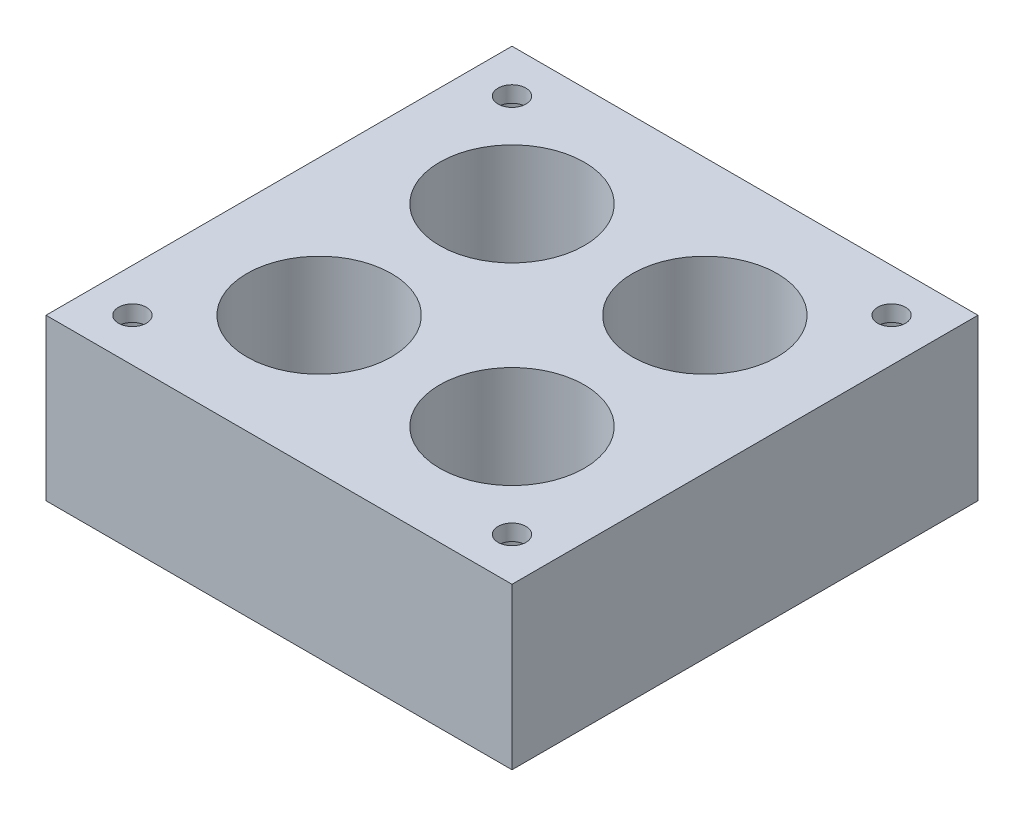
from build123d import *

# Parameters (mm, degrees)
SKETCH1_W           = 36.83
SKETCH1_H           = 36.83
SKETCH1_R           = 1.0999978
SKETCH1_R_2         = 2.159
BOSS_EXTRUDE1_DEPTH = 12.7
SKETCH2_R           = 5.715
CUT_EXTRUDE1_DEPTH  = 11.43
SKETCH3_R           = 2.54
CUT_EXTRUDE2_DEPTH  = 11.43


with BuildPart() as part:
    # Sketch1 → Boss-Extrude1 (new body)
    with BuildSketch(Plane(origin=(0, 0, 0), x_dir=(1, 0, 0), z_dir=(0, 1, 0))):
        with Locations((-1.422532637, -3.27613577)):
            Rectangle(SKETCH1_W, SKETCH1_H)
        with Locations((-16.422528037, 11.72385963)):
            Circle(SKETCH1_R, mode=Mode.SUBTRACT)
        with Locations((13.577462763, 11.72385963)):
            Circle(SKETCH1_R, mode=Mode.SUBTRACT)
        with Locations((13.577462763, -18.27613117)):
            Circle(SKETCH1_R, mode=Mode.SUBTRACT)
        with Locations((-16.422528037, -18.27613117)):
            Circle(SKETCH1_R, mode=Mode.SUBTRACT)
        with Locations((-9.042532637, 4.34386423)):
            Circle(SKETCH1_R_2, mode=Mode.SUBTRACT)
        with Locations((6.197467363, 4.34386423)):
            Circle(SKETCH1_R_2, mode=Mode.SUBTRACT)
        with Locations((6.197467363, -10.89613577)):
            Circle(SKETCH1_R_2, mode=Mode.SUBTRACT)
        with Locations((-9.042532637, -10.89613577)):
            Circle(SKETCH1_R_2, mode=Mode.SUBTRACT)
    extrude(amount=BOSS_EXTRUDE1_DEPTH)

    # Sketch2 → Cut-Extrude1 (cut)
    with BuildSketch(Plane(origin=(0, 12.7, 0), x_dir=(1, 0, 0), z_dir=(0, 1, 0))):
        with Locations((-9.042532637, 4.34386423)):
            Circle(SKETCH2_R)
        with Locations((6.197467363, 4.34386423)):
            Circle(SKETCH2_R)
        with Locations((6.197467363, -10.89613577)):
            Circle(SKETCH2_R)
        with Locations((-9.042532637, -10.89613577)):
            Circle(SKETCH2_R)
    extrude(amount=-CUT_EXTRUDE1_DEPTH, mode=Mode.SUBTRACT)

    # Sketch3 → Cut-Extrude2 (cut)
    with BuildSketch(Plane.XZ):
        with Locations((-16.422528037, 18.27613117)):
            Circle(SKETCH3_R)
        with Locations((13.577462763, 18.27613117)):
            Circle(SKETCH3_R)
        with Locations((13.577462763, -11.72385963)):
            Circle(SKETCH3_R)
        with Locations((-16.422528037, -11.72385963)):
            Circle(SKETCH3_R)
    extrude(amount=-CUT_EXTRUDE2_DEPTH, mode=Mode.SUBTRACT)


solid = part.part
